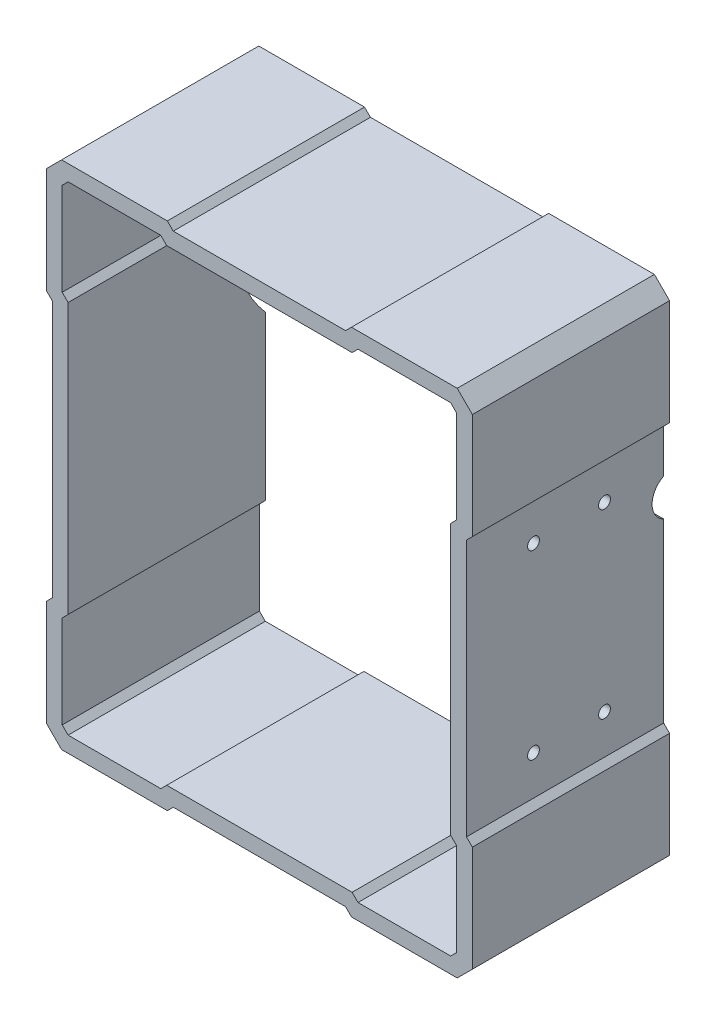
from build123d import *

# Parameters (mm, degrees)
EXTRUDE_1_DEPTH     = 10
CUT_EXTRUDE_1_DEPTH = 5
CUT_EXTRUDE_2_DEPTH = 20
EXTRUDE_2_DEPTH     = 30
SKETCH_5_R          = 1.5
CUT_EXTRUDE_3_DEPTH = 10


with BuildPart() as part:
    # 草图1 → 凸台-拉伸1 (new, symmetric)
    with BuildSketch(Plane.XY):
        Polygon((54, -31.8), (54, -23.343145751), (52.5, -21.843145751), (52.5, 43.343145751), (54, 44.843145751), (54, 71.656854249), (50.156854249, 75.5), (23.343145751, 75.5), (21.843145751, 74), (-21.843145751, 74), (-23.343145751, 75.5), (-50.156854249, 75.5), (-54, 71.656854249), (-54, 44.843145751), (-52.5, 43.343145751), (-52.5, -21.843145751), (-54, -23.343145751), (-54, -31.8), (-54, -38.2), (-54, -50.156854249), (-50.156854249, -54), (-38.2, -54), (-31.8, -54), (-23.343145751, -54), (-21.843145751, -52.5), (21.843145751, -52.5), (23.343145751, -54), (31.8, -54), (38.2, -54), (50.156854249, -54), (54, -50.156854249), (54, -38.2), align=None)
        Polygon((25, 71.5), (23.5, 70), (-23.5, 70), (-25, 71.5), (-48.5, 71.5), (-50, 70), (-50, 46.5), (-48.5, 45), (-48.5, -23.5), (-50, -25), (-50, -31.8), (-50, -38.2), (-50, -48.5), (-48.5, -50), (-38.2, -50), (-31.8, -50), (-25, -50), (-23.5, -48.5), (23.5, -48.5), (25, -50), (31.8, -50), (38.2, -50), (48.5, -50), (50, -48.5), (50, -38.2), (50, -31.8), (50, -25), (48.5, -23.5), (48.5, 45), (50, 46.5), (50, 70), (48.5, 71.5), align=None, mode=Mode.SUBTRACT)
    extrude(amount=EXTRUDE_1_DEPTH, both=True)

    # 草图2 → 切除-拉伸1 (cut, symmetric)
    with BuildSketch(Plane.ZY.offset(52.5)):
        with BuildLine():
            Line((-10, 43.343145751), (-10, 17.890895541))
            ThreePointArc((-10, 17.890895541), (-4.202580844, 27.369320914), (-1.797149123, 38.21664845))
            ThreePointArc((-1.797149123, 38.21664845), (-1.75, 40), (-1.797149123, 41.78335155))
            ThreePointArc((-1.797149123, 41.78335155), (-4.202580844, 52.630679086), (-10, 62.109104459))
            Line((-10, 62.109104459), (-10, 44.843145751))
            Line((-10, 44.843145751), (-10, 43.343145751))
        make_face()
    extrude(amount=CUT_EXTRUDE_1_DEPTH, both=True, mode=Mode.SUBTRACT)

    # 草图3 → 切除-拉伸2 (cut)
    with BuildSketch(Plane(origin=(52.5, 0, 0), x_dir=(0, 0, -1), z_dir=(1, 0, 0))):
        with BuildLine():
            Line((10, 22.968090483), (10, 32.384652471))
            ThreePointArc((10, 32.384652471), (7.072625687, 27.676371477), (10, 22.968090483))
        make_face()
    extrude(amount=-CUT_EXTRUDE_2_DEPTH, mode=Mode.SUBTRACT)

    # 草图4 → 凸台-拉伸2 (add)
    with BuildSketch(Plane.XY.offset(10)):
        Polygon((50.156854249, -54), (54, -50.156854249), (54, -23.343145751), (52.5, -21.843145751), (52.5, 43.343145751), (54, 44.843145751), (54, 71.656854249), (50.156854249, 75.5), (23.343145751, 75.5), (21.843145751, 74), (-21.843145751, 74), (-23.343145751, 75.5), (-50.156854249, 75.5), (-54, 71.656854249), (-54, 44.843145751), (-52.5, 43.343145751), (-52.5, -21.843145751), (-54, -23.343145751), (-54, -50.156854249), (-50.156854249, -54), (-23.343145751, -54), (-21.843145751, -52.5), (21.843145751, -52.5), (23.343145751, -54), align=None)
        Polygon((-23.5, 70), (23.5, 70), (25, 71.5), (48.5, 71.5), (50, 70), (50, 46.5), (48.5, 45), (48.5, -23.5), (50, -25), (50, -48.5), (48.5, -50), (25, -50), (23.5, -48.5), (-23.5, -48.5), (-25, -50), (-48.5, -50), (-50, -48.5), (-50, -25), (-48.5, -23.5), (-48.5, 45), (-50, 46.5), (-50, 70), (-48.5, 71.5), (-25, 71.5), align=None, mode=Mode.SUBTRACT)
    extrude(amount=EXTRUDE_2_DEPTH)

    # 草图5 → 切除-拉伸3 (cut)
    with BuildSketch(Plane.ZY.offset(-48.5)):
        with Locations((5, -11.868411144)):
            Circle(SKETCH_5_R)
        with Locations((23, -11.868411144)):
            Circle(SKETCH_5_R)
        with Locations((5, 34.131588856)):
            Circle(SKETCH_5_R)
        with Locations((23, 34.131588856)):
            Circle(SKETCH_5_R)
    extrude(amount=-CUT_EXTRUDE_3_DEPTH, mode=Mode.SUBTRACT)


solid = part.part
